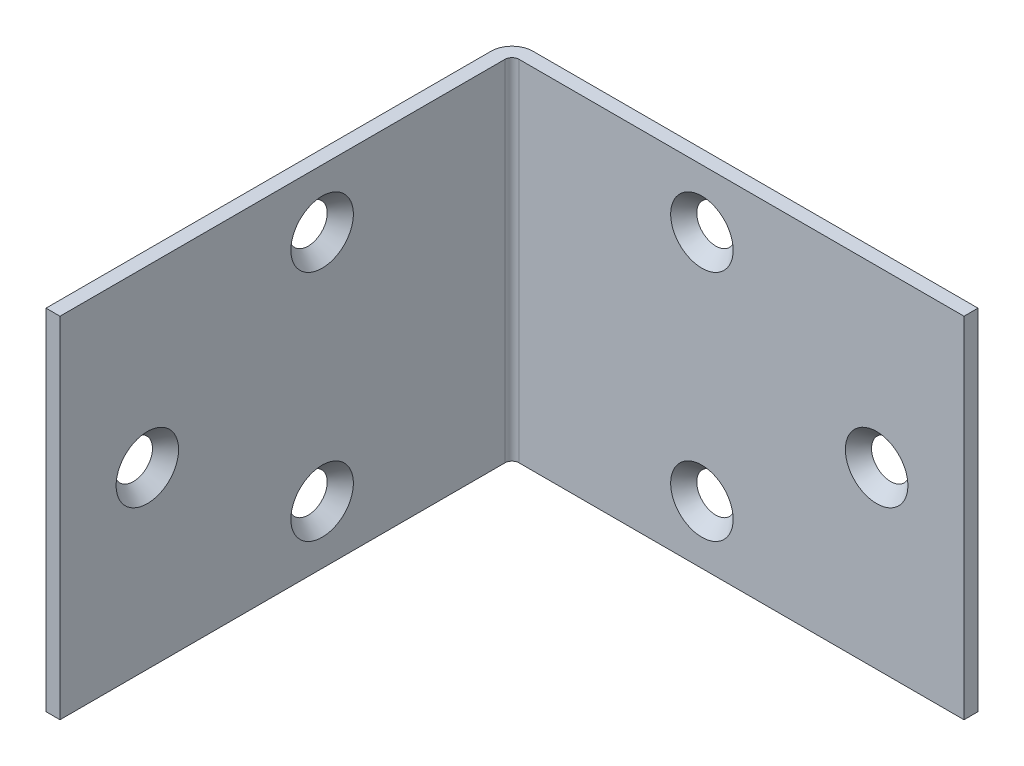
from build123d import *

# Parameters (mm, degrees)
EXTRUDE_THIN1_START          = -19.05
EXTRUDE_THIN1_DEPTH          = 38.1
SKETCH4_R                    = 2.0828
EXTRUDE3_DEPTH               = 74.291654886
SKETCH5_R                    = 2.0828
CUT_EXTRUDE1_DEPTH           = 2.54
CUT_EXTRUDE1_DRAFT           = 41
CUT_EXTRUDE1_PROFILE_2_DEPTH = 2.54
CUT_EXTRUDE1_PROFILE_2_DRAFT = 41
CUT_EXTRUDE1_PROFILE_3_DEPTH = 2.54
CUT_EXTRUDE1_PROFILE_3_DRAFT = 41
MIRROR1_COPY_1_SKETCH_R      = 2.0828
MIRROR1_COPY_1_DEPTH         = 2.54
MIRROR1_COPY_1_DRAFT         = 41
MIRROR1_COPY_2_SKETCH_R      = 2.0828
MIRROR1_COPY_2_DEPTH         = 2.54
MIRROR1_COPY_2_DRAFT         = 41
MIRROR1_COPY_3_SKETCH_R      = 2.0828
MIRROR1_COPY_3_DEPTH         = 2.54
MIRROR1_COPY_3_DRAFT         = 41
MIRROR1_COPY_4_SKETCH_R      = 2.0828
MIRROR1_COPY_4_DEPTH         = 2.54
MIRROR1_COPY_4_DRAFT         = 41
MIRROR1_COPY_5_SKETCH_R      = 2.0828
MIRROR1_COPY_5_DEPTH         = 2.54
MIRROR1_COPY_5_DRAFT         = 41


# Read off the part's stored shape, not the designer's step: Extrude-Thin1
with BuildPart() as part:
    # Extrude-Thin1 outline → Extrude-Thin1 (new body)
    with BuildSketch(Plane(origin=(0, 0, 0), x_dir=(1, 0, 0), z_dir=(0, 1, 0)).offset(EXTRUDE_THIN1_START)):
        with BuildLine():
            Line((2.286, -1.524), (50.8, -1.524))
            Line((50.8, -1.524), (50.8, 0))
            Line((50.8, 0), (2.286, 0))
            ThreePointArc((2.286, 0), (0.669553898, -0.669553898), (0, -2.286))
            Line((0, -2.286), (0, -50.8))
            Line((0, -50.8), (1.524, -50.8))
            Line((1.524, -50.8), (1.524, -2.286))
            ThreePointArc((1.524, -2.286), (1.747184633, -1.747184633), (2.286, -1.524))
        make_face()
    extrude(amount=EXTRUDE_THIN1_DEPTH)

    # Sketch4 → Extrude3 (cut, through all)
    with BuildSketch(Plane(origin=(1.524, 0, 0), x_dir=(0, 0, -1), z_dir=(1, 0, 0))):
        with Locations((-41.275, 0)):
            Circle(SKETCH4_R)
        with Locations((-22.225, 12.7)):
            Circle(SKETCH4_R)
        with Locations((-22.225, -12.7)):
            Circle(SKETCH4_R)
    extrude3 = extrude(amount=-EXTRUDE3_DEPTH, mode=Mode.SUBTRACT)


with BuildPart() as cut_extrude1_tool:
    # Sketch5 → Cut-Extrude1 (with draft: the straight prism first)
    with BuildSketch(Plane.ZY):
        with Locations((22.225, -12.7)):
            Circle(SKETCH5_R)
    extrude(amount=-CUT_EXTRUDE1_DEPTH)
    # Cut-Extrude1: the draft: its side faces are tilted about the plane it starts from
    cut_extrude1_sides = [cut_extrude1_tool.faces().sort_by_distance(p)[0] for p in [
        (1.27, -12.7, 20.1422),
    ]]
    draft(cut_extrude1_sides, Plane.ZY, CUT_EXTRUDE1_DRAFT)


with BuildPart() as part_1:
    add(part.part)

    # Cut-Extrude1: cut by cut_extrude1_tool
    add(cut_extrude1_tool.part, mode=Mode.SUBTRACT)


with BuildPart() as cut_extrude1_profile_2_tool:
    # Sketch5 → Cut-Extrude1 profile 2 (with draft: the straight prism first)
    with BuildSketch(Plane.ZY):
        with Locations((22.225, 12.7)):
            Circle(SKETCH5_R)
    extrude(amount=-CUT_EXTRUDE1_PROFILE_2_DEPTH)
    # Cut-Extrude1 profile 2: the draft: its side faces are tilted about the plane it starts from
    cut_extrude1_profile_2_sides = [cut_extrude1_profile_2_tool.faces().sort_by_distance(p)[0] for p in [
        (1.27, 12.7, 20.1422),
    ]]
    draft(cut_extrude1_profile_2_sides, Plane.ZY, CUT_EXTRUDE1_PROFILE_2_DRAFT)


with BuildPart() as part_2:
    add(part_1.part)

    # Cut-Extrude1 profile 2: cut by cut_extrude1_profile_2_tool
    add(cut_extrude1_profile_2_tool.part, mode=Mode.SUBTRACT)


with BuildPart() as cut_extrude1_profile_3_tool:
    # Sketch5 → Cut-Extrude1 profile 3 (with draft: the straight prism first)
    with BuildSketch(Plane.ZY):
        with Locations((41.275, 0)):
            Circle(SKETCH5_R)
    extrude(amount=-CUT_EXTRUDE1_PROFILE_3_DEPTH)
    # Cut-Extrude1 profile 3: the draft: its side faces are tilted about the plane it starts from
    cut_extrude1_profile_3_sides = [cut_extrude1_profile_3_tool.faces().sort_by_distance(p)[0] for p in [
        (1.27, 0, 39.1922),
    ]]
    draft(cut_extrude1_profile_3_sides, Plane.ZY, CUT_EXTRUDE1_PROFILE_3_DRAFT)


with BuildPart() as part_3:
    add(part_2.part)

    # Cut-Extrude1 profile 3: cut by cut_extrude1_profile_3_tool
    add(cut_extrude1_profile_3_tool.part, mode=Mode.SUBTRACT)

    # Mirror1: Extrude3 across plane
    add(extrude3.mirror(Plane(origin=(0, 0, 0), x_dir=(0.7071067811865465, 0, 0.7071067811865486), z_dir=(-0.7071067811865488, 0, 0.7071067811865464))), mode=Mode.SUBTRACT)


with BuildPart() as mirror1_copy_1_tool:
    # Mirror1 copy 1 sketch → Mirror1 copy 1 (with draft: the straight prism first)
    with BuildSketch(Plane(origin=(0, 0, 0), x_dir=(1, 0, 0), z_dir=(0, 0, -1))):
        with Locations((22.225, 12.7)):
            Circle(MIRROR1_COPY_1_SKETCH_R)
    extrude(amount=-MIRROR1_COPY_1_DEPTH)
    # Mirror1 copy 1: the draft: its side faces are tilted about the plane it starts from
    mirror1_copy_1_sides = [mirror1_copy_1_tool.faces().sort_by_distance(p)[0] for p in [
        (20.1422, -12.7, 1.27),
    ]]
    draft(mirror1_copy_1_sides, Plane(origin=(0, 0, 0), x_dir=(1, 0, 0), z_dir=(0, 0, -1)), MIRROR1_COPY_1_DRAFT)


with BuildPart() as part_4:
    add(part_3.part)

    # Mirror1 copy 1: cut by mirror1_copy_1_tool
    add(mirror1_copy_1_tool.part, mode=Mode.SUBTRACT)


with BuildPart() as mirror1_copy_2_tool:
    # Mirror1 copy 2 sketch → Mirror1 copy 2 (with draft: the straight prism first)
    with BuildSketch(Plane(origin=(0, 0, 0), x_dir=(1, 0, 0), z_dir=(0, 0, -1))):
        with Locations((22.225, -12.7)):
            Circle(MIRROR1_COPY_2_SKETCH_R)
    extrude(amount=-MIRROR1_COPY_2_DEPTH)
    # Mirror1 copy 2: the draft: its side faces are tilted about the plane it starts from
    mirror1_copy_2_sides = [mirror1_copy_2_tool.faces().sort_by_distance(p)[0] for p in [
        (20.1422, 12.7, 1.27),
    ]]
    draft(mirror1_copy_2_sides, Plane(origin=(0, 0, 0), x_dir=(1, 0, 0), z_dir=(0, 0, -1)), MIRROR1_COPY_2_DRAFT)


with BuildPart() as part_5:
    add(part_4.part)

    # Mirror1 copy 2: cut by mirror1_copy_2_tool
    add(mirror1_copy_2_tool.part, mode=Mode.SUBTRACT)


with BuildPart() as mirror1_copy_3_tool:
    # Mirror1 copy 3 sketch → Mirror1 copy 3 (with draft: the straight prism first)
    with BuildSketch(Plane(origin=(0, 0, 0), x_dir=(1, 0, 0), z_dir=(0, 0, -1))):
        with Locations((41.275, 0)):
            Circle(MIRROR1_COPY_3_SKETCH_R)
    extrude(amount=-MIRROR1_COPY_3_DEPTH)
    # Mirror1 copy 3: the draft: its side faces are tilted about the plane it starts from
    mirror1_copy_3_sides = [mirror1_copy_3_tool.faces().sort_by_distance(p)[0] for p in [
        (39.1922, 0, 1.27),
    ]]
    draft(mirror1_copy_3_sides, Plane(origin=(0, 0, 0), x_dir=(1, 0, 0), z_dir=(0, 0, -1)), MIRROR1_COPY_3_DRAFT)


with BuildPart() as part_6:
    add(part_5.part)

    # Mirror1 copy 3: cut by mirror1_copy_3_tool
    add(mirror1_copy_3_tool.part, mode=Mode.SUBTRACT)


with BuildPart() as mirror1_copy_4_tool:
    # Mirror1 copy 4 sketch → Mirror1 copy 4 (with draft: the straight prism first)
    with BuildSketch(Plane(origin=(0, 0, 0), x_dir=(1, 0, 0), z_dir=(0, 0, -1))):
        with Locations((22.225, -12.7)):
            Circle(MIRROR1_COPY_4_SKETCH_R)
    extrude(amount=-MIRROR1_COPY_4_DEPTH)
    # Mirror1 copy 4: the draft: its side faces are tilted about the plane it starts from
    mirror1_copy_4_sides = [mirror1_copy_4_tool.faces().sort_by_distance(p)[0] for p in [
        (20.1422, 12.7, 1.27),
    ]]
    draft(mirror1_copy_4_sides, Plane(origin=(0, 0, 0), x_dir=(1, 0, 0), z_dir=(0, 0, -1)), MIRROR1_COPY_4_DRAFT)


with BuildPart() as part_7:
    add(part_6.part)

    # Mirror1 copy 4: cut by mirror1_copy_4_tool
    add(mirror1_copy_4_tool.part, mode=Mode.SUBTRACT)


with BuildPart() as mirror1_copy_5_tool:
    # Mirror1 copy 5 sketch → Mirror1 copy 5 (with draft: the straight prism first)
    with BuildSketch(Plane(origin=(0, 0, 0), x_dir=(1, 0, 0), z_dir=(0, 0, -1))):
        with Locations((41.275, 0)):
            Circle(MIRROR1_COPY_5_SKETCH_R)
    extrude(amount=-MIRROR1_COPY_5_DEPTH)
    # Mirror1 copy 5: the draft: its side faces are tilted about the plane it starts from
    mirror1_copy_5_sides = [mirror1_copy_5_tool.faces().sort_by_distance(p)[0] for p in [
        (39.1922, 0, 1.27),
    ]]
    draft(mirror1_copy_5_sides, Plane(origin=(0, 0, 0), x_dir=(1, 0, 0), z_dir=(0, 0, -1)), MIRROR1_COPY_5_DRAFT)


with BuildPart() as part_8:
    add(part_7.part)

    # Mirror1 copy 5: cut by mirror1_copy_5_tool
    add(mirror1_copy_5_tool.part, mode=Mode.SUBTRACT)


solid = part_8.part
